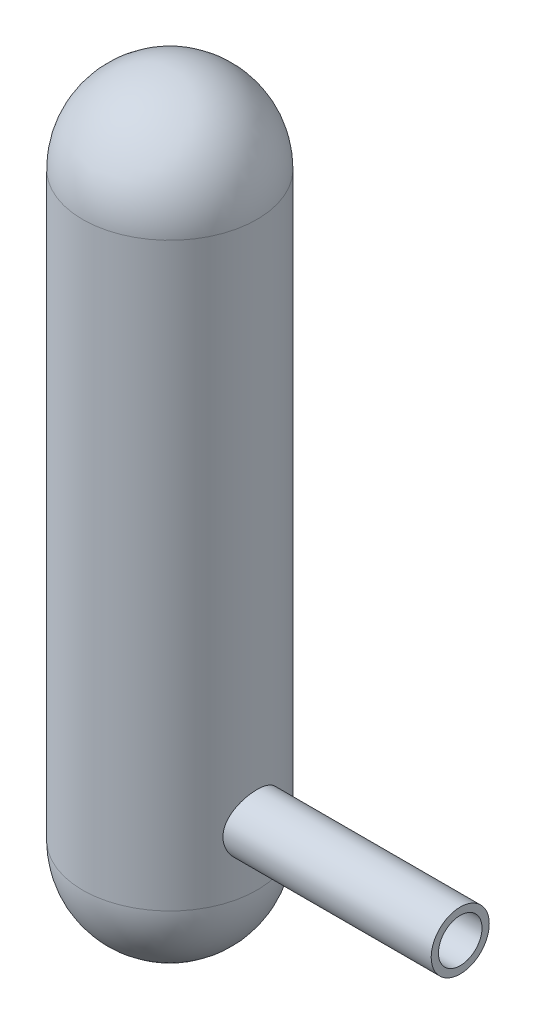
from build123d import *
from OCP.BRepAlgoAPI import BRepAlgoAPI_Cut
from OCP.TopTools import TopTools_ListOfShape
from build123d.topology import SkipClean

# Parameters (mm, degrees)
CUT_EXTRUDE1_DEPTH  = 1000
SKETCH3_R           = 300
SKETCH3_R_2         = 250
EXTRUDE_THIN1_DEPTH = 2000
SKETCH4_R           = 100
CUT_EXTRUDE2_DEPTH  = 5000
SKETCH4_3_R         = 100
SKETCH4_3_R_2       = 75
EXTRUDE_THIN2_DEPTH = 1000
SKETCH7_R           = 250
CUT_EXTRUDE3_DEPTH  = 500
REVOLVE2_ANGLE      = 180


with BuildPart() as part:
    # Sketch1 → Revolve-Thin1 (revolve)
    with BuildSketch(Plane.XY):
        with BuildLine():
            ThreePointArc((250, 0), (0, 250), (-250, 0))
            Line((-250, 0), (-300, 0))
            ThreePointArc((-300, 0), (0, 300), (300, 0))
            Line((300, 0), (250, 0))
        make_face()
    revolve(axis=Axis((-250, 0, 0), (1, 0, 0)))


with BuildPart() as cut_extrude1_tool:
    # Sketch2 → Cut-Extrude1 (new, symmetric)
    with BuildSketch(Plane.XY):
        with BuildLine():
            Line((-300, 0), (300, 0))
            ThreePointArc((300, 0), (0, 300), (-300, 0))
        make_face()
    extrude(amount=CUT_EXTRUDE1_DEPTH, both=True)


with BuildPart() as part_1:
    add(part.part)

    # Cut-Extrude1: cut by cut_extrude1_tool, with a tolerance
    cut_extrude1_stock = TopTools_ListOfShape()
    cut_extrude1_stock.Append(part_1.part.wrapped)
    cut_extrude1_tools = TopTools_ListOfShape()
    cut_extrude1_tools.Append(cut_extrude1_tool.part.wrapped)
    cut_extrude1_cut = BRepAlgoAPI_Cut()
    cut_extrude1_cut.SetArguments(cut_extrude1_stock)
    cut_extrude1_cut.SetTools(cut_extrude1_tools)
    cut_extrude1_cut.SetFuzzyValue(0.00001)
    cut_extrude1_cut.Build()
    add(Compound.cast(cut_extrude1_cut.Shape()).solids(), mode=Mode.REPLACE)

    # Sketch3 → Extrude-Thin1 (add)
    with BuildSketch(Plane(origin=(0, 0, 0), x_dir=(1, 0, 0), z_dir=(0, 1, 0))):
        Circle(SKETCH3_R)
        Circle(SKETCH3_R_2, mode=Mode.SUBTRACT)
    extrude(amount=EXTRUDE_THIN1_DEPTH)

    # Sketch4 → Cut-Extrude2 (cut)
    with BuildSketch(Plane(origin=(0, 0, 0), x_dir=(0, 0, -1), z_dir=(1, 0, 0))):
        with Locations(Location((0, 200, 0), (0, 0, 180))):
            Circle(SKETCH4_R)
    extrude(amount=CUT_EXTRUDE2_DEPTH, mode=Mode.SUBTRACT)

    # Sketch4<3> → Extrude-Thin2 (add)
    with BuildSketch(Plane(origin=(0, 0, 0), x_dir=(0, 0, -1), z_dir=(1, 0, 0))):
        with Locations((0, 200)):
            Circle(SKETCH4_3_R)
        with Locations((0, 200)):
            Circle(SKETCH4_3_R_2, mode=Mode.SUBTRACT)
    extrude(amount=EXTRUDE_THIN2_DEPTH)

    # Sketch7 → Cut-Extrude3 (cut)
    with SkipClean():  # the faces are left unmerged after this step: merging them gives an invalid solid
        with BuildSketch(Plane(origin=(0, 0, 0), x_dir=(1, 0, 0), z_dir=(0, 1, 0))):
            with Locations(Location((0, 0, 0), (0, 0, 90))):
                Circle(SKETCH7_R)
        extrude(amount=CUT_EXTRUDE3_DEPTH, mode=Mode.SUBTRACT)

    # Sketch8 → Revolve2 (revolve)
    with SkipClean():  # the faces are left unmerged after this step: merging them gives an invalid solid
        with BuildSketch(Plane(origin=(0, 2000, 0), x_dir=(1, 0, 0), z_dir=(0, 1, 0))):
            with BuildLine():
                Line((-300, 0), (300, 0))
                ThreePointArc((300, 0), (0, 300), (-300, 0))
            make_face()
        revolve(axis=Axis((-300, 2000, 0), (1, 0, 0)), revolution_arc=REVOLVE2_ANGLE)


solid = part_1.part
